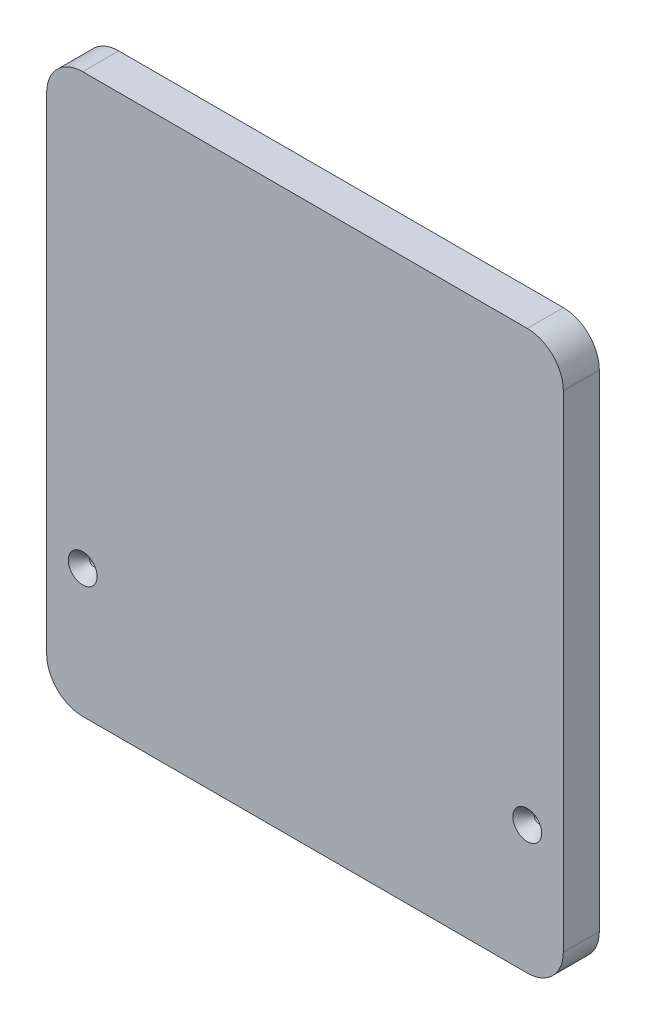
from build123d import *

# Parameters (mm, degrees)
SKETCH1_W           = 182.149999994
SKETCH1_H           = 196.85
BOSS_EXTRUDE1_DEPTH = 12.7
FILLET1_R           = 12.7
HOLE1_D             = 3.175
HOLE1_DEPTH         = 31.75
HOLE1_CSINK_D       = 10.16
HOLE1_CSINK_ANGLE   = 82
HOLE1_TIP           = 0.953866233


with BuildPart() as part:
    # Sketch1 → Boss-Extrude1 (new body)
    with BuildSketch(Plane.XY):
        with Locations((47.975000003, 766.50216301)):
            Rectangle(SKETCH1_W, SKETCH1_H)
    extrude(amount=BOSS_EXTRUDE1_DEPTH)

    # Fillet1
    fillet1_edges = [part.edges().sort_by_distance(p)[0] for p in [
        (139.05, 864.92716301, 6.35),
        (139.05, 668.07716301, 6.35),
        (-43.099999994, 668.07716301, 6.35),
        (-43.099999994, 864.92716301, 6.35),
    ]]
    fillet(fillet1_edges, radius=FILLET1_R)

    # Hole1
    with Locations(Plane(origin=(47.975000003, -425.434782605, 12.7), x_dir=(1, 0, 0), z_dir=(0, 0, 1))):
        with Locations((-78.374999997, 1310.187770337), (-78.374999997, 1138.737770337), (78.374999997, 1138.737770337), (78.374999997, 1310.187770337)):
            CounterSinkHole(HOLE1_D / 2, HOLE1_CSINK_D / 2, depth=HOLE1_DEPTH, counter_sink_angle=HOLE1_CSINK_ANGLE)
            with Locations((0, 0, -(HOLE1_DEPTH + HOLE1_TIP / 2))):  # 118° drill point
                Cone(0, HOLE1_D / 2, HOLE1_TIP, mode=Mode.SUBTRACT)


solid = part.part
